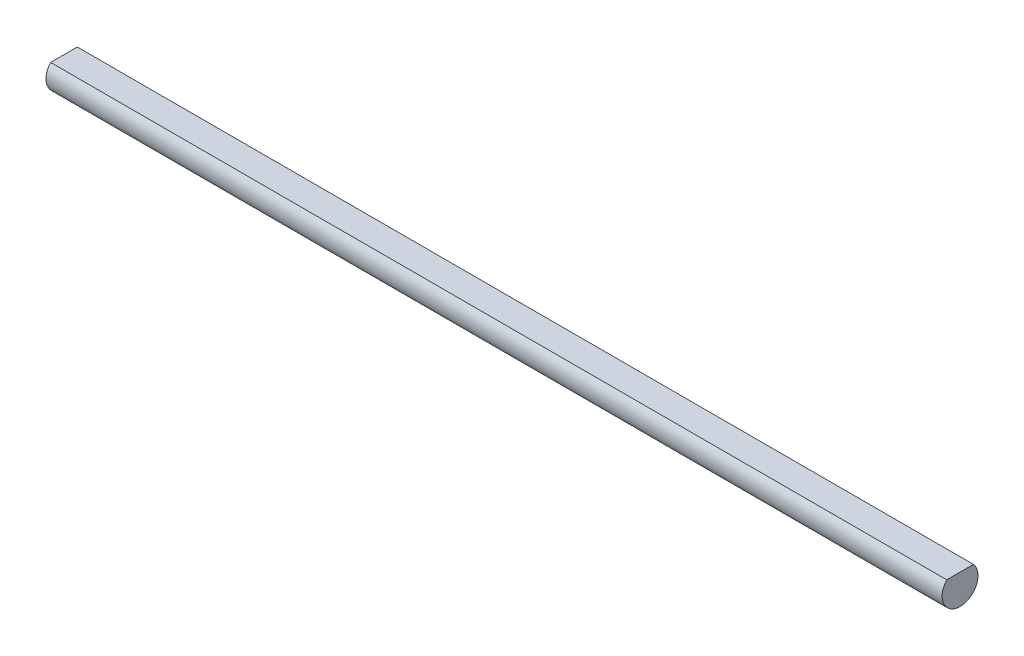
from build123d import *

# Parameters (mm, degrees)
BOSS_EXTRUDE1_DEPTH = 75


with BuildPart() as part:
    # Sketch1 → Boss-Extrude1 (new, symmetric)
    with BuildSketch(Plane(origin=(0, 0, 0), x_dir=(0, 0, -1), z_dir=(1, 0, 0))):
        with BuildLine():
            Line((-2.236067977, 2), (2.236067977, 2))
            ThreePointArc((2.236067977, 2), (0, -3), (-2.236067977, 2))
        make_face()
    extrude(amount=BOSS_EXTRUDE1_DEPTH, both=True)


solid = part.part
